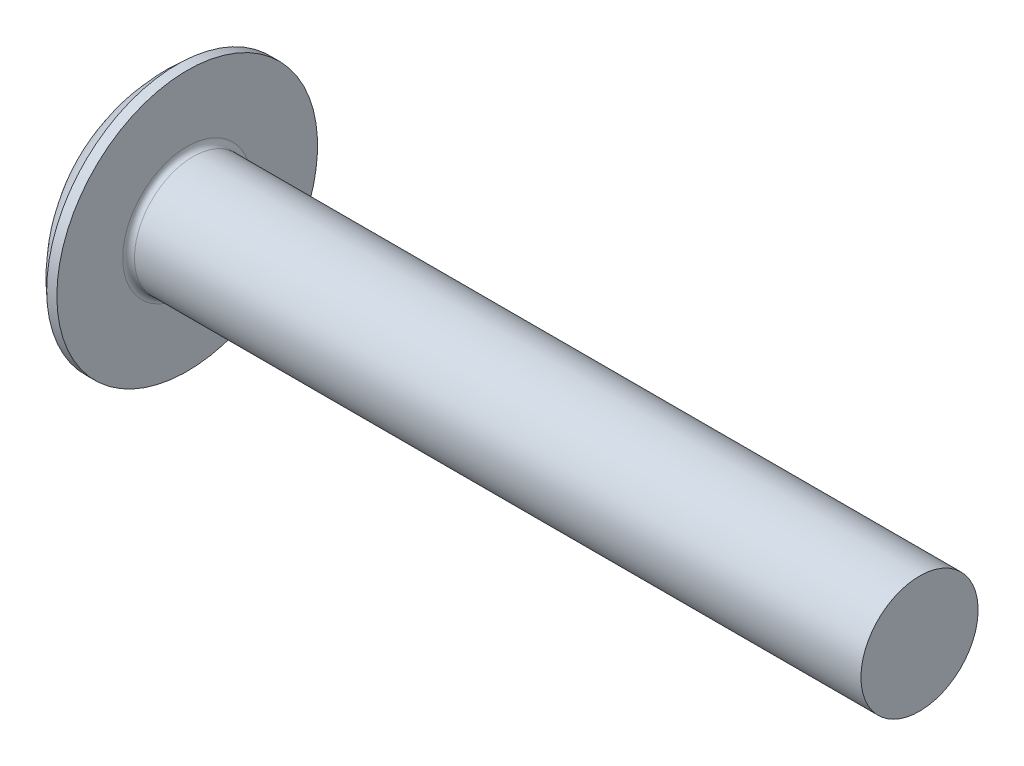
from build123d import *

# Parameters (mm, degrees)
FILLET1_R    = 0.4
RECPAT_COUNT = 2
RECPAT_ANGLE = 90


with BuildPart() as part:
    # BodySke → BaseBody (revolve)
    with BuildSketch(Plane.XY):
        with BuildLine():
            Line((4.8, 4), (4.8, 8.9))
            Line((4.8, 8.9), (4.105264982, 8.9))
            ThreePointArc((4.105264982, 8.9), (1.075772976, 4.900591816), (0, 0))
            Line((0, 0), (54.8, 0))
            Line((54.8, 0), (54.8, 4))
            Line((54.8, 4), (4.8, 4))
        make_face()
    revolve(axis=Axis((0, 0, 0), (1, 0, 0)))

    # Fillet1
    fillet1_edges = [part.edges().sort_by_distance(p)[0] for p in [
        (4.8, -4, 0),
    ]]
    fillet(fillet1_edges, radius=FILLET1_R)

    # RecSkeTop → Recess section 0
    with BuildSketch(Plane(origin=(0, 0, 0), x_dir=(0, 0, -1), z_dir=(1, 0, 0))):
        with BuildLine():
            Line((-0.858, 3.9), (0.858, 3.9))
            Line((0.858, 3.9), (0.858, -3.9))
            Line((0.858, -3.9), (-0.858, -3.9))
            Line((-0.858, -3.9), (-0.858, 3.9))
        make_face()
    # RecSkeBot → Recess section 1
    with BuildSketch(Plane(origin=(4.36, 0, 0), x_dir=(0, 0, -1), z_dir=(1, 0, 0))):
        with BuildLine():
            Line((-0.858, 1.726184552), (0.858, 1.726184552))
            Line((0.858, 1.726184552), (0.858, -1.726184552))
            Line((0.858, -1.726184552), (-0.858, -1.726184552))
            Line((-0.858, -1.726184552), (-0.858, 1.726184552))
        make_face()
    recess = loft(mode=Mode.SUBTRACT)

    # RecPat: Recess ×2 about axis
    recpat_axis = Axis((0, 0, 0), (1, 0, 0))
    for i in range(1, RECPAT_COUNT):
        add(recess.rotate(recpat_axis, i * RECPAT_ANGLE / (RECPAT_COUNT - 1)), mode=Mode.SUBTRACT)

    # RecCorSke → RecessCore (revolve, cut)
    with BuildSketch(Plane.XY):
        Polygon((0, 0), (0, 1.8876), (4.36, 1.5827191), (4.874256609, 0), align=None)
    revolve(axis=Axis((0, 0, 0), (1, 0, 0)), mode=Mode.SUBTRACT)


solid = part.part
